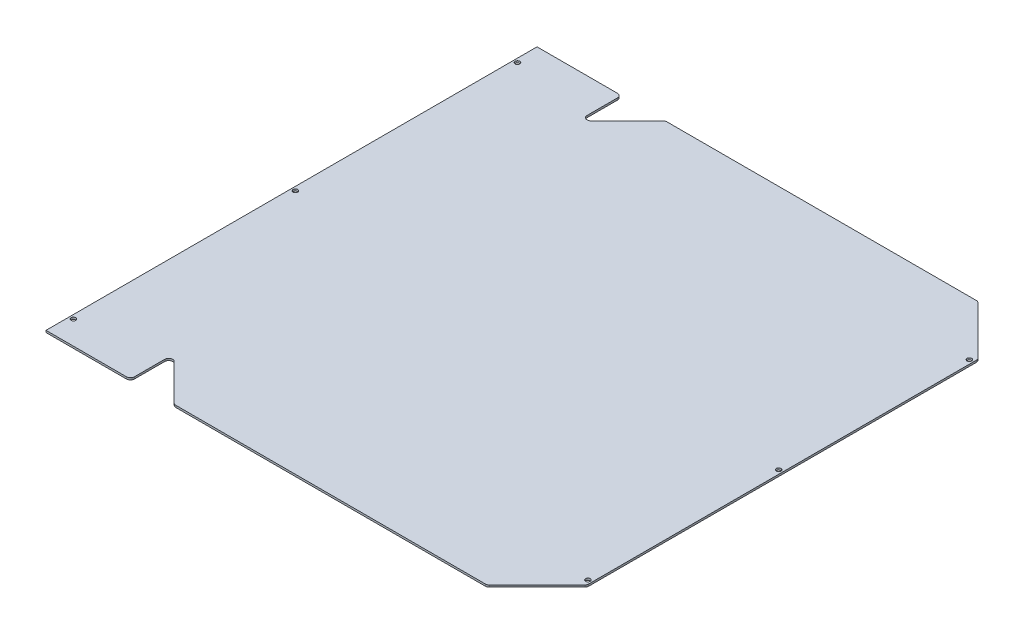
from build123d import *

# Parameters (mm, degrees)
BOSS_EXTRUDE1_DEPTH   = 1.5875
F_6_CLEARANCE_HOLE1_D = 3.7973
FILLET1_R             = 3.175


with BuildPart() as part:
    # Sketch1 → Boss-Extrude1 (new body)
    with BuildSketch(Plane(origin=(0, 0, 0), x_dir=(1, 0, 0), z_dir=(0, 1, 0))):
        Polygon((199.39, 158.75), (158.75, 199.39), (-95.25, 199.39), (-130.81, 163.83), (-130.81, 199.39), (-199.39, 199.39), (-199.39, -199.39), (-130.81, -199.39), (-130.81, -163.83), (-95.25, -199.39), (158.75, -199.39), (199.39, -158.75), align=None)
    extrude(amount=-BOSS_EXTRUDE1_DEPTH)

    # #6 Clearance Hole1 (through all)
    with Locations(Plane(origin=(0, -1.5875, 0), x_dir=(-1, 0, 0), z_dir=(0, -1, 0))):
        with Locations((196.215, 180.34), (196.215, -180.34), (-196.215, -154.94), (-196.215, 154.94), (196.215, 0), (-196.215, 0)):
            Hole(F_6_CLEARANCE_HOLE1_D / 2)

    # Fillet1
    fillet1_edges = [part.edges().sort_by_distance(p)[0] for p in [
        (158.75, -0.79375, -199.39),
        (199.39, -0.79375, -158.75),
        (199.39, -0.79375, 158.75),
        (158.75, -0.79375, 199.39),
        (-130.81, -0.79375, 163.83),
        (-130.81, -0.79375, 199.39),
        (-95.25, -0.79375, 199.39),
        (-95.25, -0.79375, -199.39),
        (-130.81, -0.79375, -199.39),
        (-130.81, -0.79375, -163.83),
    ]]
    fillet(fillet1_edges, radius=FILLET1_R)


solid = part.part
